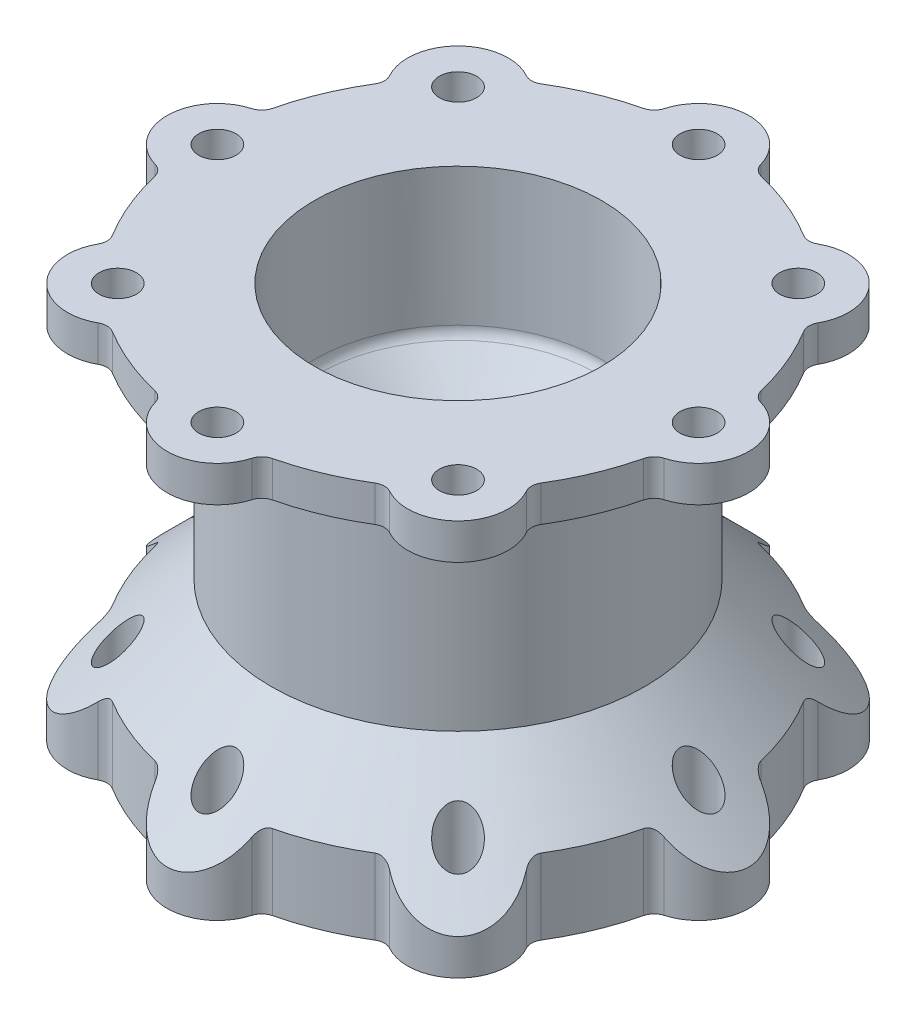
from build123d import *

# Parameters (mm, degrees)
M6_CLEARANCE_HOLE1_AT_2_COUNT = 2
M6_CLEARANCE_HOLE1_AT_2_PITCH = 42.545
M6_CLEARANCE_HOLE1_AT_3_COUNT = 2
M6_CLEARANCE_HOLE1_AT_3_PITCH = 42.545
M6_CLEARANCE_HOLE1_AT_4_COUNT = 2
M6_CLEARANCE_HOLE1_AT_4_PITCH = 42.545
M6_CLEARANCE_HOLE1_AT_5_COUNT = 2
M6_CLEARANCE_HOLE1_AT_5_PITCH = 42.545
M6_CLEARANCE_HOLE1_AT_6_COUNT = 2
M6_CLEARANCE_HOLE1_AT_6_PITCH = 42.545
M6_CLEARANCE_HOLE1_AT_7_COUNT = 2
M6_CLEARANCE_HOLE1_AT_7_PITCH = 42.545
M6_CLEARANCE_HOLE1_AT_8_COUNT = 2
M6_CLEARANCE_HOLE1_AT_8_PITCH = 42.545
M6_CLEARANCE_HOLE1_AT_9_COUNT = 2
M6_CLEARANCE_HOLE1_AT_9_PITCH = 42.545
SCALLOP_DEPTH                 = 137.16
TURB_RING_FILLET_R            = 2.54


with BuildPart() as part:
    # Sketch1 → Chamber (revolve)
    with BuildSketch(Plane(origin=(0, 0, 0), x_dir=(0, 0, -1), z_dir=(1, 0, 0))):
        Polygon((25.4, 69.999999954), (57.15, 69.999999954), (57.15, 63.649999954), (33.02, 63.649999954), (33.02, 39.519999954), (33.02, 30.48), (33.02, 24.765), (51.435, 6.35), (57.15, 6.35), (57.15, 0), (25.4, 0), (25.4, 6.35), (25.4, 63.649999954), align=None)
    revolve(axis=Axis((0, 0, 0), (0, 1, 0)))

    # Sketch15 → M6 Clearance Hole1 (revolve, cut)
    with BuildSketch(Plane(origin=(0, 69.999999954, 0), x_dir=(0, 0, 1), z_dir=(1, 0, 0))):
        Polygon((0, 0), (0, 69.999999954), (3.325, 69.999999954), (3.3, 69.974999954), (3.3, 0), align=None)
    m6_clearance_hole1 = revolve(axis=Axis((0, 76.349999954, 0), (0, -1, 0)), mode=Mode.SUBTRACT)

    # M6 Clearance Hole1 at 2: M6 Clearance Hole1 ×2
    with Locations(*[(-i * M6_CLEARANCE_HOLE1_AT_2_PITCH, 0, 0) for i in range(1, M6_CLEARANCE_HOLE1_AT_2_COUNT)]):
        add(m6_clearance_hole1, mode=Mode.SUBTRACT)

    # M6 Clearance Hole1 at 3: M6 Clearance Hole1 ×2
    with Locations(*[Vector(-0.70710678118655, 0, -0.7071067811865451) * (i * M6_CLEARANCE_HOLE1_AT_3_PITCH) for i in range(1, M6_CLEARANCE_HOLE1_AT_3_COUNT)]):
        add(m6_clearance_hole1, mode=Mode.SUBTRACT)

    # M6 Clearance Hole1 at 4: M6 Clearance Hole1 ×2
    with Locations(*[(0, 0, -i * M6_CLEARANCE_HOLE1_AT_4_PITCH) for i in range(1, M6_CLEARANCE_HOLE1_AT_4_COUNT)]):
        add(m6_clearance_hole1, mode=Mode.SUBTRACT)

    # M6 Clearance Hole1 at 5: M6 Clearance Hole1 ×2
    with Locations(*[Vector(0.7071067811865331, 0, -0.707106781186562) * (i * M6_CLEARANCE_HOLE1_AT_5_PITCH) for i in range(1, M6_CLEARANCE_HOLE1_AT_5_COUNT)]):
        add(m6_clearance_hole1, mode=Mode.SUBTRACT)

    # M6 Clearance Hole1 at 6: M6 Clearance Hole1 ×2
    with Locations(*[(i * M6_CLEARANCE_HOLE1_AT_6_PITCH, 0, 0) for i in range(1, M6_CLEARANCE_HOLE1_AT_6_COUNT)]):
        add(m6_clearance_hole1, mode=Mode.SUBTRACT)

    # M6 Clearance Hole1 at 7: M6 Clearance Hole1 ×2
    with Locations(*[Vector(0.7071067811865621, 0, 0.707106781186533) * (i * M6_CLEARANCE_HOLE1_AT_7_PITCH) for i in range(1, M6_CLEARANCE_HOLE1_AT_7_COUNT)]):
        add(m6_clearance_hole1, mode=Mode.SUBTRACT)

    # M6 Clearance Hole1 at 8: M6 Clearance Hole1 ×2
    with Locations(*[(0, 0, i * M6_CLEARANCE_HOLE1_AT_8_PITCH) for i in range(1, M6_CLEARANCE_HOLE1_AT_8_COUNT)]):
        add(m6_clearance_hole1, mode=Mode.SUBTRACT)

    # M6 Clearance Hole1 at 9: M6 Clearance Hole1 ×2
    with Locations(*[Vector(-0.7071067811865451, 0, 0.7071067811865499) * (i * M6_CLEARANCE_HOLE1_AT_9_PITCH) for i in range(1, M6_CLEARANCE_HOLE1_AT_9_COUNT)]):
        add(m6_clearance_hole1, mode=Mode.SUBTRACT)


with BuildPart() as body_2:
    # Sketch17 → Scallop (new body)
    with BuildSketch(Plane(origin=(0, 69.999999954, 0), x_dir=(1, 0, 0), z_dir=(0, 1, 0))):
        with BuildLine():
            ThreePointArc((8.54755536, 44.988644279), (0, 51.435), (-8.54755536, 44.988644279))
            ThreePointArc((-8.54755536, 44.988644279), (-9.232140391, 43.853106764), (-10.395675438, 43.217270069))
            ThreePointArc((-10.395675438, 43.217270069), (-17.010278569, 41.06644522), (-23.208372132, 37.910077327))
            ThreePointArc((-23.208372132, 37.910077327), (-24.480720094, 37.536938244), (-25.767741088, 37.855809804))
            ThreePointArc((-25.767741088, 37.855809804), (-36.37003729, 36.37003729), (-37.855809804, 25.767741088))
            ThreePointArc((-37.855809804, 25.767741088), (-37.536938244, 24.480720094), (-37.910077327, 23.208372132))
            ThreePointArc((-37.910077327, 23.208372132), (-41.06644522, 17.010278569), (-43.217270069, 10.395675438))
            ThreePointArc((-43.217270069, 10.395675438), (-43.853106764, 9.232140391), (-44.988644279, 8.54755536))
            ThreePointArc((-44.988644279, 8.54755536), (-51.435, 0), (-44.988644279, -8.54755536))
            ThreePointArc((-44.988644279, -8.54755536), (-43.853106764, -9.232140391), (-43.217270069, -10.395675438))
            ThreePointArc((-43.217270069, -10.395675438), (-41.06644522, -17.010278569), (-37.910077327, -23.208372132))
            ThreePointArc((-37.910077327, -23.208372132), (-37.536938244, -24.480720094), (-37.855809804, -25.767741088))
            ThreePointArc((-37.855809804, -25.767741088), (-36.37003729, -36.37003729), (-25.767741088, -37.855809804))
            ThreePointArc((-25.767741088, -37.855809804), (-24.480720094, -37.536938244), (-23.208372132, -37.910077327))
            ThreePointArc((-23.208372132, -37.910077327), (-17.010278569, -41.06644522), (-10.395675438, -43.217270069))
            ThreePointArc((-10.395675438, -43.217270069), (-9.232140391, -43.853106764), (-8.54755536, -44.988644279))
            ThreePointArc((-8.54755536, -44.988644279), (0, -51.435), (8.54755536, -44.988644279))
            ThreePointArc((8.54755536, -44.988644279), (9.232140391, -43.853106764), (10.395675438, -43.217270069))
            ThreePointArc((10.395675438, -43.217270069), (17.010278569, -41.06644522), (23.208372132, -37.910077327))
            ThreePointArc((23.208372132, -37.910077327), (24.480720094, -37.536938244), (25.767741088, -37.855809804))
            ThreePointArc((25.767741088, -37.855809804), (36.37003729, -36.37003729), (37.855809804, -25.767741088))
            ThreePointArc((37.855809804, -25.767741088), (37.536938244, -24.480720094), (37.910077327, -23.208372132))
            ThreePointArc((37.910077327, -23.208372132), (41.06644522, -17.010278569), (43.217270069, -10.395675438))
            ThreePointArc((43.217270069, -10.395675438), (43.853106764, -9.232140391), (44.988644279, -8.54755536))
            ThreePointArc((44.988644279, -8.54755536), (51.435, 0), (44.988644279, 8.54755536))
            ThreePointArc((44.988644279, 8.54755536), (43.853106764, 9.232140391), (43.217270069, 10.395675438))
            ThreePointArc((43.217270069, 10.395675438), (41.06644522, 17.010278569), (37.910077327, 23.208372132))
            ThreePointArc((37.910077327, 23.208372132), (37.536938244, 24.480720094), (37.855809804, 25.767741088))
            ThreePointArc((37.855809804, 25.767741088), (36.37003729, 36.37003729), (25.767741088, 37.855809804))
            ThreePointArc((25.767741088, 37.855809804), (24.480720094, 37.536938244), (23.208372132, 37.910077327))
            ThreePointArc((23.208372132, 37.910077327), (17.010278569, 41.06644522), (10.395675438, 43.217270069))
            ThreePointArc((10.395675438, 43.217270069), (9.232140391, 43.853106764), (8.54755536, 44.988644279))
        make_face()
    extrude(amount=-SCALLOP_DEPTH)

    # Intersect2: read off the stored shape, not the designer's step
    # Intersect2: intersect part
    add(part.part, mode=Mode.INTERSECT)

    # Sketch18 → Turbulence Ring (revolve)
    with BuildSketch(Plane(origin=(0, 0, 0), x_dir=(0, 0, -1), z_dir=(1, 0, 0)), mode=Mode.PRIVATE) as turbulence_ring_sk:
        with BuildLine():
            Line((-25.4, 44.599999954), (-10.531974388, 29.731974342))
            ThreePointArc((-10.531974388, 29.731974342), (-10.531974388, 27.935923118), (-12.328025612, 27.935923118))
            Line((-12.328025612, 27.935923118), (-25.4, 41.007897506))
            Line((-25.4, 41.007897506), (-25.4, 44.599999954))
        make_face()
    revolve(turbulence_ring_sk.sketch.rotate(Axis((0, 78.763374349, 0), (0, -1, 0)), 180), axis=Axis((0, 78.763374349, 0), (0, -1, 0)))

    # Turb. Ring Fillet
    turb_ring_fillet_edges = [body_2.edges().sort_by_distance(p)[0] for p in [
        (0, 41.007897506, 25.4),
        (0, 44.599999954, 25.4),
    ]]
    fillet(turb_ring_fillet_edges, radius=TURB_RING_FILLET_R)


solid = body_2.part
